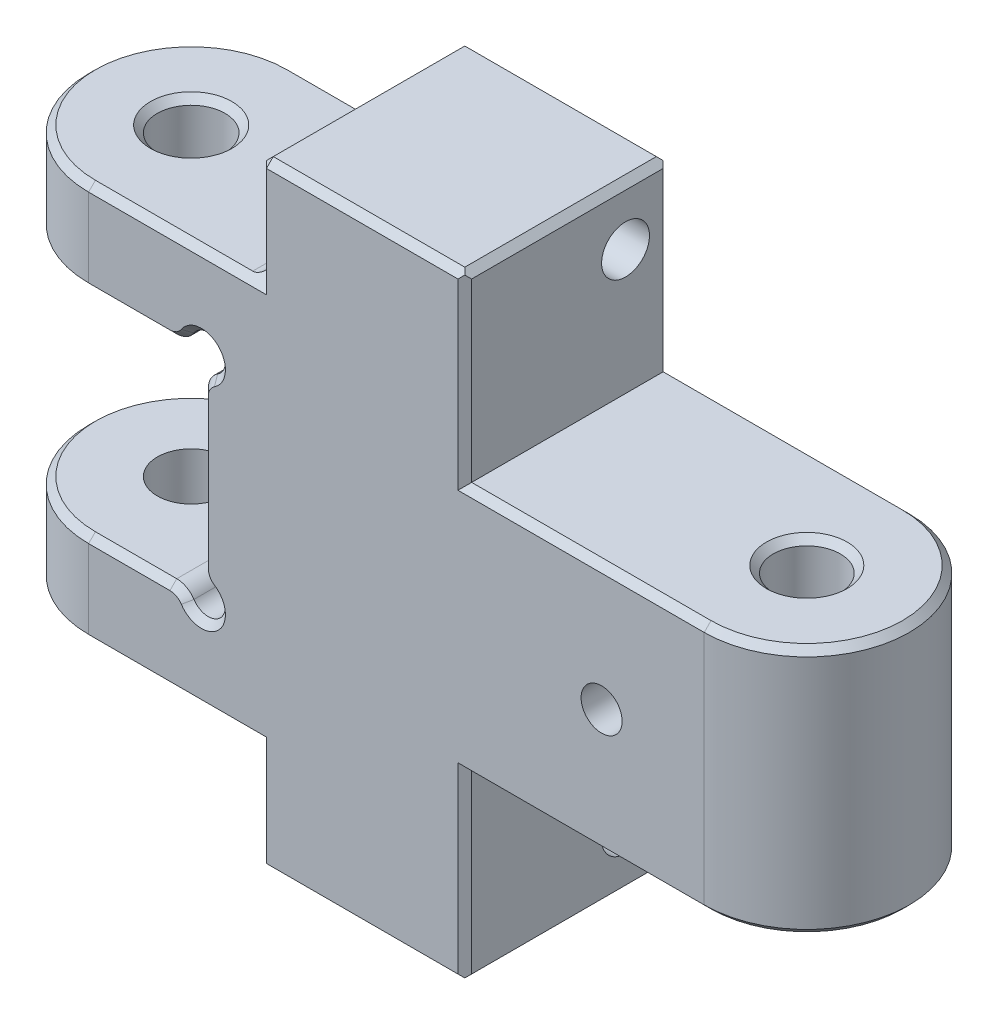
from build123d import *

# Parameters (mm, degrees)
SKETCH1_R           = 0.495
SKETCH1_R_2         = 0.49
BOSS_EXTRUDE1_DEPTH = 1.825
SKETCH3_W           = 3
SKETCH3_H           = 3
BOSS_EXTRUDE4_DEPTH = 4.5
SKETCH6_W           = 4
SKETCH6_H           = 5.8
BOSS_EXTRUDE5_DEPTH = 3
SKETCH8_R           = 0.495
CUT_EXTRUDE4_DEPTH  = 5
SKETCH7_W           = 6.3
SKETCH7_H           = 3.1
CUT_EXTRUDE3_DEPTH  = 10
SKETCH9_R           = 0.25
CUT_EXTRUDE5_DEPTH  = 9.077747211
SKETCH4_R           = 0.35
CUT_EXTRUDE1_DEPTH  = 10.300537619
SKETCH5_R           = 0.3
CUT_EXTRUDE2_DEPTH  = 10
FILLET3_R           = 0.3
FILLET4_R           = 1.5
CHAMFER1_SIZE       = 0.1
CHAMFER2_SIZE       = 0.1
CHAMFER3_SIZE       = 0.1
CHAMFER4_SIZE       = 0.1
FILLET5_R           = 0.2


# Some blends are built 0.0001 mm under size
with BuildPart() as part:
    # Sketch1 → Boss-Extrude1 (new, symmetric)
    with BuildSketch(Plane(origin=(0, 0, 0), x_dir=(1, 0, 0), z_dir=(0, 1, 0))):
        with BuildLine():
            Line((-4.5, 1.5), (4.5, 1.5))
            ThreePointArc((4.5, 1.5), (6, 0), (4.5, -1.5))
            Line((4.5, -1.5), (-4.5, -1.5))
            ThreePointArc((-4.5, -1.5), (-6, 0), (-4.5, 1.5))
        make_face()
        with Locations(Location((-4.5, 0, 0), (0, 0, 270))):
            Circle(SKETCH1_R, mode=Mode.SUBTRACT)
        with Locations(Location((4.5, 0, 0), (0, 0, 270))):
            Circle(SKETCH1_R_2, mode=Mode.SUBTRACT)
    extrude(amount=BOSS_EXTRUDE1_DEPTH, both=True)

    # Sketch3 → Boss-Extrude4 (add, symmetric)
    with BuildSketch(Plane(origin=(0, 0, 0), x_dir=(1, 0, 0), z_dir=(0, 1, 0))):
        with Locations((-0.5, 0)):
            Rectangle(SKETCH3_W, SKETCH3_H)
    extrude(amount=BOSS_EXTRUDE4_DEPTH, both=True)

    # Sketch6 → Boss-Extrude5 (add)
    with BuildSketch(Plane(origin=(0, 0, -1.5), x_dir=(-1, 0, 0), z_dir=(0, 0, -1))):
        with Locations((4, 0)):
            Rectangle(SKETCH6_W, SKETCH6_H)
    extrude(amount=-BOSS_EXTRUDE5_DEPTH)

    # Sketch8 → Cut-Extrude4 (cut, symmetric)
    with BuildSketch(Plane(origin=(0, 0, 0), x_dir=(1, 0, 0), z_dir=(0, 1, 0))):
        with Locations((-4.5, 0)):
            Circle(SKETCH8_R)
    extrude(amount=CUT_EXTRUDE4_DEPTH, both=True, mode=Mode.SUBTRACT)

    # Sketch7 → Cut-Extrude3 (cut)
    with BuildSketch(Plane(origin=(0, 0, -1.5), x_dir=(-1, 0, 0), z_dir=(0, 0, -1))):
        with Locations((6, 0)):
            Rectangle(SKETCH7_W, SKETCH7_H)
    extrude(amount=-CUT_EXTRUDE3_DEPTH, mode=Mode.SUBTRACT)

    # Sketch9 → Cut-Extrude5 (cut, through all)
    with BuildSketch(Plane(origin=(0, 0, -1.5), x_dir=(-1, 0, 0), z_dir=(0, 0, -1))):
        with Locations((2.85, 1.55)):
            Circle(SKETCH9_R)
        with Locations((2.85, -1.55)):
            Circle(SKETCH9_R)
    extrude(amount=-CUT_EXTRUDE5_DEPTH, mode=Mode.SUBTRACT)

    # Sketch4 → Cut-Extrude1 (cut, through all)
    with BuildSketch(Plane.ZY.offset(2)):
        with Locations((-0.85, 3.65)):
            Circle(SKETCH4_R)
        with Locations((-0.85, -3.65)):
            Circle(SKETCH4_R)
    extrude(amount=-CUT_EXTRUDE1_DEPTH, mode=Mode.SUBTRACT)

    # Sketch5 → Cut-Extrude2 (cut)
    with BuildSketch(Plane.XY.offset(1.5)):
        with Locations((3, 0)):
            Circle(SKETCH5_R)
    extrude(amount=-CUT_EXTRUDE2_DEPTH, mode=Mode.SUBTRACT)

    # Fillet3
    fillet3_edges = [part.edges().sort_by_distance(p)[0] for p in [
        (-3.1, 1.55, 0),
        (-2.85, 1.3, 0),
        (-3.1, -1.55, 0),
        (-2.85, -1.3, 0),
    ]]
    fillet(fillet3_edges, radius=FILLET3_R)

    # Fillet4
    fillet4_edges = [part.edges().sort_by_distance(p)[0] for p in [
        (-6, 2.225, 1.5),
        (-6, 2.225, -1.5),
        (-6, -2.225, 1.5),
        (-6, -2.225, -1.5),
    ]]
    fillet(fillet4_edges, radius=FILLET4_R - 0.0001)  # a hair under: the kernel refuses the full size

    # Chamfer1
    chamfer1_edges = [part.edges().sort_by_distance(p)[0] for p in [
        (4.5, -1.825, -0.49),
        (4.5, 1.825, -0.49),
        (-4.995, -2.9, 0),
        (-4.995, 2.9, 0),
    ]]
    chamfer(chamfer1_edges, length=CHAMFER1_SIZE)

    # Chamfer2
    chamfer2_edges = [part.edges().sort_by_distance(p)[0] for p in [
        (6, 1.825, 0),
        (2.75, 1.825, -1.5),
        (2.75, -1.825, 1.5),
        (2.75, 1.825, 1.5),
        (1, -3.1625, -1.5),
        (1, -3.1625, 1.5),
        (1, -4.5, 0),
        (1, 3.1625, 1.5),
        (1, 3.1625, -1.5),
        (1, 4.5, 0),
        (2.75, -1.825, -1.5),
        (6, -1.825, 0),
    ]]
    chamfer(chamfer2_edges, length=CHAMFER2_SIZE)

    # Chamfer3
    # the kernel refuses this chamfer: 0.1 mm, written as the material it takes off along each edge
    with BuildSketch(Plane(origin=(-4.5001, -1.55, 1.5), x_dir=(0, 0.02749587661058508, -0.9996219169112966), z_dir=(1, 0, 0)), Plane(origin=(-3.310977223, 1.55, 1.5), x_dir=(0, -0.027495876610587243, -0.9996219169112966), z_dir=(-1, 0, 0))) as chamfer3_piece_1:
        Polygon((CHAMFER3_SIZE * 0.999621916911, -CHAMFER3_SIZE * 0.0274958766106), (-CHAMFER3_SIZE * 0.0274958766106, -CHAMFER3_SIZE * 0.999621916911), (0, 0), align=None)
    extrude(amount=1.189122777, mode=Mode.SUBTRACT)
    with BuildSketch(Plane(origin=(-3.310977223, -1.55, -1.5), x_dir=(0, -0.9996219169112966, -0.027495876610587302), z_dir=(-1, 0, 0)), Plane(origin=(-4.5001, 1.55, -1.5), x_dir=(0, 0.9996219169112966, -0.027495876610587302), z_dir=(1, 0, 0))) as chamfer3_piece_2:
        Polygon((CHAMFER3_SIZE * 0.999621916911, CHAMFER3_SIZE * 0.0274958766106), (-CHAMFER3_SIZE * 0.0274958766106, CHAMFER3_SIZE * 0.999621916911), (0, 0), align=None)
    extrude(amount=1.189122777, mode=Mode.SUBTRACT)
    with BuildSketch(Plane(origin=(-2.85, -1.55, -1.5), x_dir=(0.545454545454545, 0.8381404052084447, 0), z_dir=(-0.8381404052084447, 0.545454545454545, 0))) as chamfer3_piece_3:
        Polygon((0.25 + CHAMFER3_SIZE, 0), (0.25, -CHAMFER3_SIZE), (0.25, 0), align=None)
    revolve(axis=Axis((-2.85, -1.55, -1.5), (0, 0, -1)), revolution_arc=203.888537698, mode=Mode.SUBTRACT)
    with BuildSketch(Plane(origin=(-2.85, 1.089022777, -1.5), x_dir=(0.9996219169112966, 0, -0.02749587661058718), z_dir=(0, -1, 0))) as chamfer3_piece_4:
        Polygon((CHAMFER3_SIZE * 0.999621916911, CHAMFER3_SIZE * 0.0274958766106), (-CHAMFER3_SIZE * 0.0274958766106, CHAMFER3_SIZE * 0.999621916911), (0, 0), align=None)
    extrude(amount=2.178045554, mode=Mode.SUBTRACT)
    with BuildSketch(Plane(origin=(-2.85, 1.55, -1.5), x_dir=(-0.8381404052084445, 0.5454545454545454, 0), z_dir=(-0.5454545454545454, -0.8381404052084445, 0))) as chamfer3_piece_5:
        Polygon((0.25 + CHAMFER3_SIZE, 0), (0.25, -CHAMFER3_SIZE), (0.25, 0), align=None)
    revolve(axis=Axis((-2.85, 1.55, -1.5), (0, 0, -1)), revolution_arc=203.888537698, mode=Mode.SUBTRACT)
    with BuildSketch(Plane(origin=(-2.55, 1.089022777, -1.5), x_dir=(-0.5454545454545466, 0.8381404052084436, 0), z_dir=(0.8381404052084436, 0.5454545454545466, 0))) as chamfer3_piece_6:
        Polygon((0.3 - CHAMFER3_SIZE, 0), (0.3, CHAMFER3_SIZE), (0.3, 0), align=None)
    revolve(axis=Axis((-2.55, 1.089022777, -1.5), (0, 0, 1)), revolution_arc=56.944268849, mode=Mode.SUBTRACT)
    with BuildSketch(Plane(origin=(-3.310977223, 1.85, -1.5), x_dir=(0, -1, 0), z_dir=(-1, 0, 0))) as chamfer3_piece_7:
        Polygon((0.3 - CHAMFER3_SIZE, 0), (0.3, CHAMFER3_SIZE), (0.3, 0), align=None)
    revolve(axis=Axis((-3.310977223, 1.85, -1.5), (0, 0, 1)), revolution_arc=56.944268849, mode=Mode.SUBTRACT)
    with BuildSketch(Plane(origin=(-2.55, -1.089022777, -1.5), x_dir=(-1, 0, 0), z_dir=(0, 1, 0))) as chamfer3_piece_8:
        Polygon((0.3 - CHAMFER3_SIZE, 0), (0.3, CHAMFER3_SIZE), (0.3, 0), align=None)
    revolve(axis=Axis((-2.55, -1.089022777, -1.5), (0, 0, 1)), revolution_arc=56.944268849, mode=Mode.SUBTRACT)
    with BuildSketch(Plane(origin=(-3.310977223, -1.85, -1.5), x_dir=(0.8381404052084445, 0.5454545454545453, 0), z_dir=(0.5454545454545453, -0.8381404052084445, 0))) as chamfer3_piece_9:
        Polygon((0.3 - CHAMFER3_SIZE, 0), (0.3, CHAMFER3_SIZE), (0.3, 0), align=None)
    revolve(axis=Axis((-3.310977223, -1.85, -1.5), (0, 0, 1)), revolution_arc=56.944268849, mode=Mode.SUBTRACT)
    with BuildSketch(Plane(origin=(-2.85, -1.55, 1.5), x_dir=(0.545454545454545, 0.8381404052084447, 0), z_dir=(-0.8381404052084447, 0.545454545454545, 0))) as chamfer3_piece_10:
        Polygon((0.25, CHAMFER3_SIZE), (0.25 + CHAMFER3_SIZE, 0), (0.25, 0), align=None)
    revolve(axis=Axis((-2.85, -1.55, 1.5), (0, 0, -1)), revolution_arc=203.888537698, mode=Mode.SUBTRACT)
    with BuildSketch(Plane(origin=(-2.85, -1.089022777, 1.5), x_dir=(-0.027495876610587302, 0, -0.9996219169112966), z_dir=(0, 1, 0))) as chamfer3_piece_11:
        Polygon((CHAMFER3_SIZE * 0.999621916911, -CHAMFER3_SIZE * 0.0274958766106), (-CHAMFER3_SIZE * 0.0274958766106, -CHAMFER3_SIZE * 0.999621916911), (0, 0), align=None)
    extrude(amount=2.178045554, mode=Mode.SUBTRACT)
    with BuildSketch(Plane(origin=(-2.85, 1.55, 1.5), x_dir=(-0.8381404052084445, 0.5454545454545454, 0), z_dir=(-0.5454545454545454, -0.8381404052084445, 0))) as chamfer3_piece_12:
        Polygon((0.25, CHAMFER3_SIZE), (0.25 + CHAMFER3_SIZE, 0), (0.25, 0), align=None)
    revolve(axis=Axis((-2.85, 1.55, 1.5), (0, 0, -1)), revolution_arc=203.888537698, mode=Mode.SUBTRACT)
    with BuildSketch(Plane(origin=(-2.55, 1.089022777, 1.5), x_dir=(-0.5454545454545453, 0.8381404052084445, 0), z_dir=(0.8381404052084445, 0.5454545454545453, 0))) as chamfer3_piece_13:
        Polygon((0.3, -CHAMFER3_SIZE), (0.3 - CHAMFER3_SIZE, 0), (0.3, 0), align=None)
    revolve(axis=Axis((-2.55, 1.089022777, 1.5), (0, 0, 1)), revolution_arc=56.944268849, mode=Mode.SUBTRACT)
    with BuildSketch(Plane(origin=(-3.310977223, 1.85, 1.5), x_dir=(0, -1, 0), z_dir=(-1, 0, 0))) as chamfer3_piece_14:
        Polygon((0.3, -CHAMFER3_SIZE), (0.3 - CHAMFER3_SIZE, 0), (0.3, 0), align=None)
    revolve(axis=Axis((-3.310977223, 1.85, 1.5), (0, 0, 1)), revolution_arc=56.944268849, mode=Mode.SUBTRACT)
    with BuildSketch(Plane(origin=(-2.55, -1.089022777, 1.5), x_dir=(-1, 0, 0), z_dir=(0, 1, 0))) as chamfer3_piece_15:
        Polygon((0.3, -CHAMFER3_SIZE), (0.3 - CHAMFER3_SIZE, 0), (0.3, 0), align=None)
    revolve(axis=Axis((-2.55, -1.089022777, 1.5), (0, 0, 1)), revolution_arc=56.944268849, mode=Mode.SUBTRACT)
    with BuildSketch(Plane(origin=(-3.310977223, -1.85, 1.5), x_dir=(0.8381404052084445, 0.5454545454545453, 0), z_dir=(0.5454545454545453, -0.8381404052084445, 0))) as chamfer3_piece_16:
        Polygon((0.3, -CHAMFER3_SIZE), (0.3 - CHAMFER3_SIZE, 0), (0.3, 0), align=None)
    revolve(axis=Axis((-3.310977223, -1.85, 1.5), (0, 0, 1)), revolution_arc=56.944268849, mode=Mode.SUBTRACT)
    with BuildSketch(Plane(origin=(-4.5001, -2.9, 1.5), x_dir=(0, -0.027495876610587243, -0.9996219169112966), z_dir=(1, 0, 0)), Plane(origin=(-2, 2.9, -1.5), x_dir=(0, -0.9996219169112966, -0.027495876610587302), z_dir=(-1, 0, 0)), Plane(origin=(-4.5001, -2.9, -1.5), x_dir=(0, 0.9996219169112966, -0.027495876610587302), z_dir=(1, 0, 0)), Plane(origin=(-2, 2.9, 1.5), x_dir=(0, 0.027495876610587302, -0.9996219169112966), z_dir=(-1, 0, 0))) as chamfer3_piece_17:
        Polygon((CHAMFER3_SIZE * 0.999621916911, CHAMFER3_SIZE * 0.0274958766106), (-CHAMFER3_SIZE * 0.0274958766106, CHAMFER3_SIZE * 0.999621916911), (0, 0), align=None)
    extrude(amount=2.5001, mode=Mode.SUBTRACT)
    with BuildSketch(Plane(origin=(-4.5001, 1.55, -0.0001), x_dir=(0, 0, -1), z_dir=(1, 0, 0))) as chamfer3_piece_18:
        Polygon((1.4999, CHAMFER3_SIZE), (1.4999 - CHAMFER3_SIZE, 0), (1.4999, 0), align=None)
    revolve(axis=Axis((-4.5001, 1.55, -0.0001), (0, 1, 0)), revolution_arc=90, mode=Mode.SUBTRACT)
    with BuildSketch(Plane(origin=(-4.5001, 1.55, 0.0001), x_dir=(-1, 0, 0), z_dir=(0, 0, -1))) as chamfer3_piece_19:
        Polygon((1.4999 - CHAMFER3_SIZE, 0), (1.4999, CHAMFER3_SIZE), (1.4999, 0), align=None)
    revolve(axis=Axis((-4.5001, 1.55, 0.0001), (0, 1, 0)), revolution_arc=90, mode=Mode.SUBTRACT)
    with BuildSketch(Plane(origin=(-4.5001, 2.9, -0.0001), x_dir=(0, 0, -1), z_dir=(1, 0, 0))) as chamfer3_piece_20:
        Polygon((1.4999 - CHAMFER3_SIZE, 0), (1.4999, -CHAMFER3_SIZE), (1.4999, 0), align=None)
    revolve(axis=Axis((-4.5001, 2.9, -0.0001), (0, 1, 0)), revolution_arc=90, mode=Mode.SUBTRACT)
    with BuildSketch(Plane(origin=(-4.5001, 2.9, 0.0001), x_dir=(-1, 0, 0), z_dir=(0, 0, -1))) as chamfer3_piece_21:
        Polygon((1.4999 - CHAMFER3_SIZE, 0), (1.4999, -CHAMFER3_SIZE), (1.4999, 0), align=None)
    revolve(axis=Axis((-4.5001, 2.9, 0.0001), (0, 1, 0)), revolution_arc=90, mode=Mode.SUBTRACT)
    with BuildSketch(Plane(origin=(-4.5001, -2.9, -0.0001), x_dir=(0, 0, -1), z_dir=(1, 0, 0))) as chamfer3_piece_22:
        Polygon((1.4999 - CHAMFER3_SIZE, 0), (1.4999, CHAMFER3_SIZE), (1.4999, 0), align=None)
    revolve(axis=Axis((-4.5001, -2.9, -0.0001), (0, 1, 0)), revolution_arc=90, mode=Mode.SUBTRACT)
    with BuildSketch(Plane(origin=(-4.5001, -2.9, 0.0001), x_dir=(-1, 0, 0), z_dir=(0, 0, -1))) as chamfer3_piece_23:
        Polygon((1.4999 - CHAMFER3_SIZE, 0), (1.4999, CHAMFER3_SIZE), (1.4999, 0), align=None)
    revolve(axis=Axis((-4.5001, -2.9, 0.0001), (0, 1, 0)), revolution_arc=90, mode=Mode.SUBTRACT)
    with BuildSketch(Plane(origin=(-4.5001, -1.55, -0.0001), x_dir=(0, 0, -1), z_dir=(1, 0, 0))) as chamfer3_piece_24:
        Polygon((1.4999, -CHAMFER3_SIZE), (1.4999 - CHAMFER3_SIZE, 0), (1.4999, 0), align=None)
    revolve(axis=Axis((-4.5001, -1.55, -0.0001), (0, 1, 0)), revolution_arc=90, mode=Mode.SUBTRACT)
    with BuildSketch(Plane(origin=(-4.5001, -1.55, 0.0001), x_dir=(-1, 0, 0), z_dir=(0, 0, -1))) as chamfer3_piece_25:
        Polygon((1.4999 - CHAMFER3_SIZE, 0), (1.4999, -CHAMFER3_SIZE), (1.4999, 0), align=None)
    revolve(axis=Axis((-4.5001, -1.55, 0.0001), (0, 1, 0)), revolution_arc=90, mode=Mode.SUBTRACT)
    with BuildSketch(Plane(origin=(-6, -1.55, 0.0001), x_dir=(0.9996219169112966, 0.02749587661058742, 0), z_dir=(0, 0, -1)), Plane(origin=(-6, -1.55, 0), x_dir=(0.9996219169112966, 0.02749587661058742, 0), z_dir=(0, 0, -1)), Plane(origin=(-6, 1.55, 0), x_dir=(0.9996219169112966, -0.02749587661058742, 0), z_dir=(0, 0, 1)), Plane(origin=(-6, 1.55, -0.0001), x_dir=(0.9996219169112966, -0.02749587661058742, 0), z_dir=(0, 0, 1))) as chamfer3_piece_26:
        Polygon((CHAMFER3_SIZE * 0.999621916911, CHAMFER3_SIZE * 0.0274958766106), (-CHAMFER3_SIZE * 0.0274958766106, CHAMFER3_SIZE * 0.999621916911), (0, 0), align=None)
    extrude(amount=0.0001, mode=Mode.SUBTRACT)
    with BuildSketch(Plane(origin=(-6, -2.9, -0.0001), x_dir=(0.9996219169112966, -0.02749587661058742, 0), z_dir=(0, 0, 1))) as chamfer3_piece_27:
        Polygon((CHAMFER3_SIZE * 0.999621916911, CHAMFER3_SIZE * 0.0274958766106), (-CHAMFER3_SIZE * 0.0274958766106, CHAMFER3_SIZE * 0.999621916911), (0, 0), align=None)
    extrude(amount=0.0002, mode=Mode.SUBTRACT)
    with BuildSketch(Plane(origin=(-6, 2.9, -0.0001), x_dir=(0.9996219169112966, 0.02749587661058742, 0), z_dir=(0, 0, 1))) as chamfer3_piece_28:
        Polygon((CHAMFER3_SIZE * 0.999621916911, -CHAMFER3_SIZE * 0.0274958766106), (-CHAMFER3_SIZE * 0.0274958766106, -CHAMFER3_SIZE * 0.999621916911), (0, 0), align=None)
    extrude(amount=0.0002, mode=Mode.SUBTRACT)

    # Chamfer4
    chamfer4_edges = [part.edges().sort_by_distance(p)[0] for p in [
        (-2, 3.65, 1.5),
        (-0.55, 4.5, 1.5),
        (-2, 4.5, 0),
        (-0.55, 4.5, -1.5),
        (-2, 3.65, -1.5),
        (-0.55, -4.5, 1.5),
        (-0.55, -4.5, -1.5),
        (-2, -3.65, 1.5),
        (-2, -4.5, 0),
        (-2, -3.65, -1.5),
    ]]
    chamfer(chamfer4_edges, length=CHAMFER4_SIZE)

    # Fillet5
    fillet5_edges = [part.edges().sort_by_distance(p)[0] for p in [
        (-2, -2.9, 0),
        (-2, 2.9, 0),
    ]]
    fillet(fillet5_edges, radius=FILLET5_R)


solid = part.part
